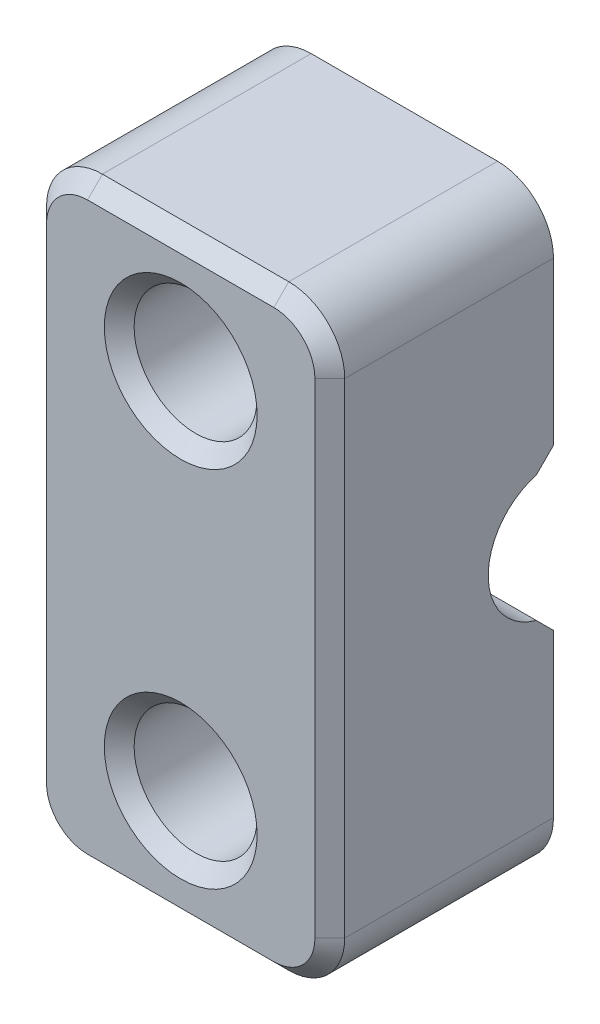
from build123d import *

# Parameters (mm, degrees)
SKETCH2_W           = 8
SKETCH2_H           = 16
BOSS_EXTRUDE1_DEPTH = 6
CUT_EXTRUDE1_DEPTH  = 8
SKETCH4_R           = 1.65
CUT_EXTRUDE2_DEPTH  = 6
FILLET1_R           = 1.5
CHAMFER1_SIZE       = 0.4
CHAMFER2_SIZE       = 0.4


with BuildPart() as part:
    # Sketch2 → Boss-Extrude1 (new body)
    with BuildSketch(Plane.XY):
        Rectangle(SKETCH2_W, SKETCH2_H)
    extrude(amount=BOSS_EXTRUDE1_DEPTH)

    # Sketch3 → Cut-Extrude1 (cut)
    with BuildSketch(Plane.ZY.offset(4)):
        with BuildLine():
            ThreePointArc((0, 1.75), (-1.75, 0), (0, -1.75))
            Line((0, -1.75), (0, 1.75))
        make_face()
        with BuildLine():
            Line((0, 1.75), (0, -1.75))
            ThreePointArc((0, -1.75), (1.237436867, -1.237436867), (1.75, 0))
            ThreePointArc((1.75, 0), (1.237436867, 1.237436867), (0, 1.75))
        make_face()
    extrude(amount=-CUT_EXTRUDE1_DEPTH, mode=Mode.SUBTRACT)

    # Sketch4 → Cut-Extrude2 (cut)
    with BuildSketch(Plane(origin=(0, 0, 0), x_dir=(-1, 0, 0), z_dir=(0, 0, -1))):
        with Locations((0, -4.875)):
            Circle(SKETCH4_R)
        with Locations((0, 4.875)):
            Circle(SKETCH4_R)
    extrude(amount=-CUT_EXTRUDE2_DEPTH, mode=Mode.SUBTRACT)

    # Fillet1
    fillet1_edges = [part.edges().sort_by_distance(p)[0] for p in [
        (4, -8, 3),
        (-4, -8, 3),
        (-4, 8, 3),
        (4, 8, 3),
    ]]
    fillet(fillet1_edges, radius=FILLET1_R)

    # Chamfer1
    chamfer1_edges = [part.edges().sort_by_distance(p)[0] for p in [
        (1.65, -4.875, 6),
        (1.65, 4.875, 6),
        (4, 0, 6),
        (0, -8, 6),
        (0, 8, 6),
        (-4, 0, 6),
        (3.560660172, 7.560660172, 6),
        (-3.560660172, 7.560660172, 6),
        (-3.560660172, -7.560660172, 6),
        (3.560660172, -7.560660172, 6),
    ]]
    chamfer(chamfer1_edges, length=CHAMFER1_SIZE)

    # Chamfer2
    # the kernel refuses this chamfer: 0.4 mm, written as the material it takes off along each edge
    with BuildSketch(Plane(origin=(5.197730184, -1.75, 0), x_dir=(0, 0.1332210476636025, 0.9910863496484109), z_dir=(-1, 0, 0))) as chamfer2_piece_1:
        with BuildLine():
            Line((0.466273667, 0), (-CHAMFER2_SIZE * 0.133221047664, -CHAMFER2_SIZE * 0.991086349648))
            Line((-CHAMFER2_SIZE * 0.133221047664, -CHAMFER2_SIZE * 0.991086349648), (0, 0))
            ThreePointArc((0, 0), (0.23957204, -0.015587056), (0.466273667, 0))
        make_face()
    extrude(amount=10.395460367, mode=Mode.SUBTRACT)
    with BuildSketch(Plane(origin=(-5.197730184, 1.75, 0), x_dir=(0, 1, 0), z_dir=(1, 0, 0))) as chamfer2_piece_2:
        with BuildLine():
            Line((CHAMFER2_SIZE, 0), (-0.062117466, 0.462117466))
            ThreePointArc((-0.062117466, 0.462117466), (-0.01646792, 0.239513102), (0, 0))
            Line((0, 0), (CHAMFER2_SIZE, 0))
        make_face()
    extrude(amount=10.395460367, mode=Mode.SUBTRACT)


solid = part.part
